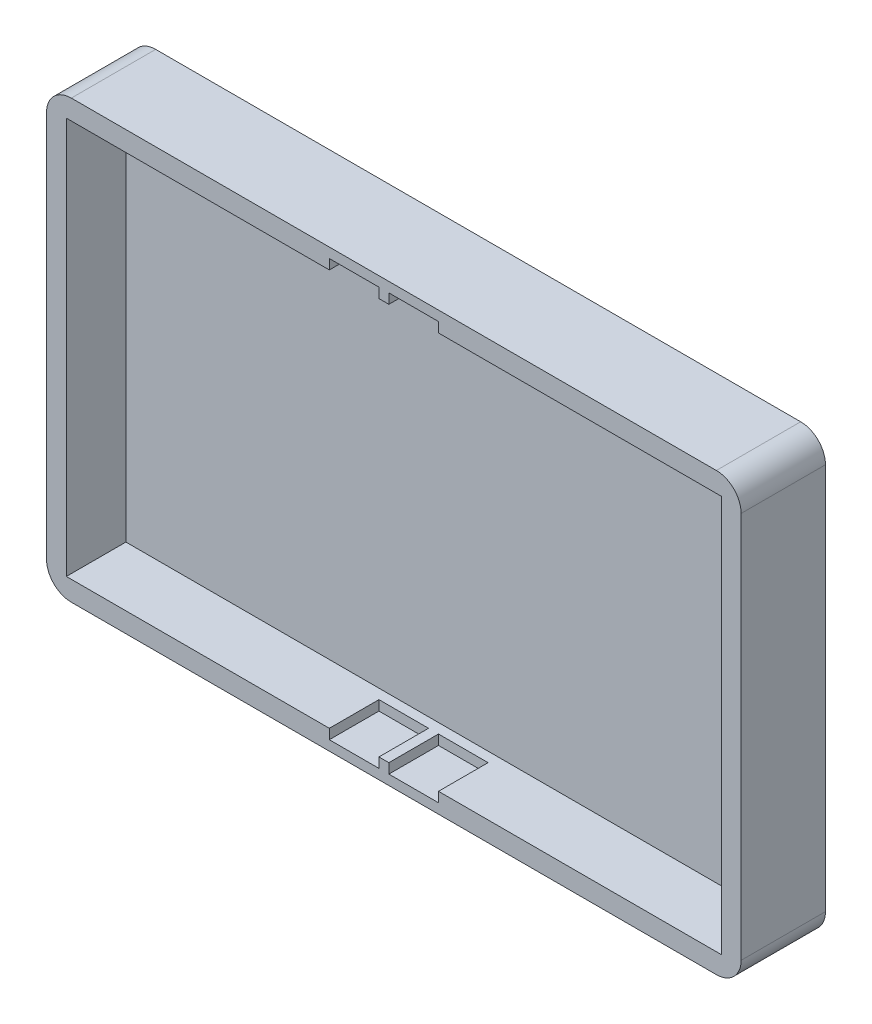
from build123d import *

# Parameters (mm, degrees)
SKETCH1_W               = 70
SKETCH1_H               = 44
BOSS_EXTRUDE1_DEPTH     = 8.5
SKETCH2_W               = 66
SKETCH2_H               = 40
CUT_EXTRUDE1_DEPTH      = 6
CUT_EXTRUDE2_DEPTH      = 41
CUT_EXTRUDE2_DEPTH_BACK = 1
SKETCH4_W               = 5
SKETCH4_H               = 4
CORNER_FILLET_R         = 2.5
SKETCH5_W               = 5
SKETCH5_H               = 1
CUT_EXTRUDE3_DEPTH      = 1
SKETCH6_W               = 5
SKETCH6_H               = 1
CUT_EXTRUDE4_DEPTH      = 1
SKETCH7_W               = 5
SKETCH7_H               = 1
CUT_EXTRUDE5_DEPTH      = 1
SKETCH8_W               = 5
SKETCH8_H               = 1
CUT_EXTRUDE6_DEPTH      = 1


with BuildPart() as part:
    # Sketch1 → Boss-Extrude1 (new body)
    with BuildSketch(Plane.XY):
        with Locations((35, 22)):
            Rectangle(SKETCH1_W, SKETCH1_H)
    extrude(amount=BOSS_EXTRUDE1_DEPTH)

    # Sketch2 → Cut-Extrude1 (cut)
    with BuildSketch(Plane.XY.offset(8.5)):
        with Locations((35, 22)):
            Rectangle(SKETCH2_W, SKETCH2_H)
    extrude(amount=-CUT_EXTRUDE1_DEPTH, mode=Mode.SUBTRACT)

    # Sketch4 → Cut-Extrude2 (cut, two sides: drawn at the far end of the back side and taken through both)
    with BuildSketch(Plane.XZ.offset(-42).offset(-CUT_EXTRUDE2_DEPTH_BACK)):
        with Locations((31, 5.5)):
            Rectangle(SKETCH4_W, SKETCH4_H)
        with Locations((37, 5.5)):
            Rectangle(SKETCH4_W, SKETCH4_H)
    extrude(amount=CUT_EXTRUDE2_DEPTH + CUT_EXTRUDE2_DEPTH_BACK, mode=Mode.SUBTRACT)

    # Corner Fillet
    corner_fillet_edges = [part.edges().sort_by_distance(p)[0] for p in [
        (0, 44, 4.25),
        (0, 0, 4.25),
        (70, 0, 4.25),
        (70, 44, 4.25),
    ]]
    fillet(corner_fillet_edges, radius=CORNER_FILLET_R)

    # Sketch5 → Cut-Extrude3 (cut)
    with BuildSketch(Plane(origin=(0, 2, 0), x_dir=(1, 0, 0), z_dir=(0, 1, 0))):
        with Locations((31, -8)):
            Rectangle(SKETCH5_W, SKETCH5_H)
    extrude(amount=-CUT_EXTRUDE3_DEPTH, mode=Mode.SUBTRACT)

    # Sketch6 → Cut-Extrude4 (cut)
    with BuildSketch(Plane.XZ.offset(-42)):
        with Locations((37, 8)):
            Rectangle(SKETCH6_W, SKETCH6_H)
    extrude(amount=-CUT_EXTRUDE4_DEPTH, mode=Mode.SUBTRACT)

    # Sketch7 → Cut-Extrude5 (cut)
    with BuildSketch(Plane(origin=(0, 2, 0), x_dir=(1, 0, 0), z_dir=(0, 1, 0))):
        with Locations((37, -8)):
            Rectangle(SKETCH7_W, SKETCH7_H)
    extrude(amount=-CUT_EXTRUDE5_DEPTH, mode=Mode.SUBTRACT)

    # Sketch8 → Cut-Extrude6 (cut)
    with BuildSketch(Plane.XZ.offset(-42)):
        with Locations((31, 8)):
            Rectangle(SKETCH8_W, SKETCH8_H)
    extrude(amount=-CUT_EXTRUDE6_DEPTH, mode=Mode.SUBTRACT)


solid = part.part
